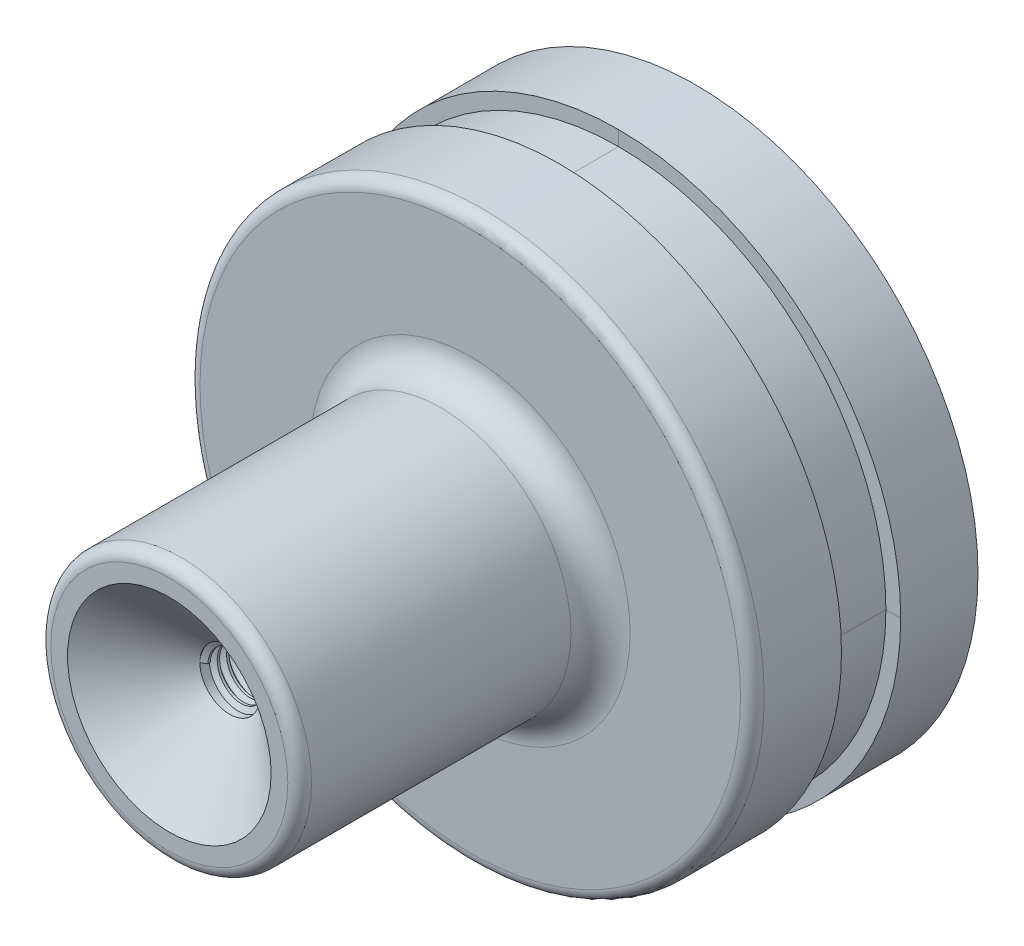
from build123d import *

# Parameters (mm, degrees)
SKETCH1_R                                           = 47.625
BOSS_EXTRUDE1_DEPTH                                 = 88.9
SKETCH2_OUTSIDE_W                                   = 129.528
SKETCH2_OUTSIDE_H                                   = 129.528
SKETCH2_OUTSIDE_R                                   = 22
CUT_EXTRUDE2_DEPTH                                  = 50.8
CSK_FOR_3_8_FLAT_HEAD_MACHINE_SCREW_100_D           = 10.0838
CSK_FOR_3_8_FLAT_HEAD_MACHINE_SCREW_100_DEPTH       = 25
CSK_FOR_3_8_FLAT_HEAD_MACHINE_SCREW_100_CSINK_D     = 34.3708482
CSK_FOR_3_8_FLAT_HEAD_MACHINE_SCREW_100_CSINK_ANGLE = 100
CSK_FOR_3_8_FLAT_HEAD_MACHINE_SCREW_100_TIP         = 3.029479155
THREAD1_PITCH                                       = 1.5875
FILLET1_R                                           = 2
FILLET2_R                                           = 5
SKETCH15_R                                          = 40.8125
CUT_EXTRUDE3_DEPTH                                  = 15
SKETCH19_W                                          = 10
SKETCH19_H                                          = 5
SCALE1_SCALE                                        = 0.49
SCALE2_SCALE                                        = 0.894
SCALE3_SCALE                                        = 0.8184


with BuildPart() as part:
    # Sketch1 → Boss-Extrude1 (new body)
    with BuildSketch(Plane.XY):
        Circle(SKETCH1_R)
    extrude(amount=BOSS_EXTRUDE1_DEPTH)

    # Sketch2 outside → Cut-Extrude2 (cut)
    with BuildSketch(Plane.XY.offset(88.9)):
        Rectangle(SKETCH2_OUTSIDE_W, SKETCH2_OUTSIDE_H)
        Circle(SKETCH2_OUTSIDE_R, mode=Mode.SUBTRACT)
    extrude(amount=-CUT_EXTRUDE2_DEPTH, mode=Mode.SUBTRACT)

    # CSK for 3/8 Flat Head Machine Screw (100)1
    with Locations(Plane.XY.offset(88.9)):
        with Locations((0, 0)):
            CounterSinkHole(CSK_FOR_3_8_FLAT_HEAD_MACHINE_SCREW_100_D / 2, CSK_FOR_3_8_FLAT_HEAD_MACHINE_SCREW_100_CSINK_D / 2, depth=CSK_FOR_3_8_FLAT_HEAD_MACHINE_SCREW_100_DEPTH, counter_sink_angle=CSK_FOR_3_8_FLAT_HEAD_MACHINE_SCREW_100_CSINK_ANGLE)
            with Locations((0, 0, -(CSK_FOR_3_8_FLAT_HEAD_MACHINE_SCREW_100_DEPTH + CSK_FOR_3_8_FLAT_HEAD_MACHINE_SCREW_100_TIP / 2))):  # 118° drill point
                Cone(0, CSK_FOR_3_8_FLAT_HEAD_MACHINE_SCREW_100_D / 2, CSK_FOR_3_8_FLAT_HEAD_MACHINE_SCREW_100_TIP, mode=Mode.SUBTRACT)

    # Thread1: the profile of Thread Profile1 profile screwed along a right-hand helix of 10.07874 turns, 8 arcs to a turn; built about Z, then put on its axis
    thread1_z = Axis((0, 0, 0), (0, 0, 1))
    thread1_corners = [(5.0422, 0, -0.000173206), (5.0422, 0, 1.3892357), (4.182640423, 0, 0.892968747), (4.182640423, 0, 0.496093747)]
    with BuildLine(mode=Mode.PRIVATE) as thread1_profile:
        Line(thread1_corners[0], thread1_corners[1])
        Line(thread1_corners[1], thread1_corners[2])
        Line(thread1_corners[2], thread1_corners[3])
        Line(thread1_corners[3], thread1_corners[0])
    thread1_cap = Face(thread1_profile.wire())
    thread1_turn_angles = [0, 22.5, 45, 67.5, 90, 112.5, 135, 157.5, 180, 202.5, 225, 247.5, 270, 292.5, 315, 337.5, 360]
    thread1_turn_weights = [1, 0.9238795325112867, 1, 0.9238795325112867, 1, 0.9238795325112867, 1, 0.9238795325112867, 1, 0.9238795325112867, 1, 0.9238795325112867, 1, 0.9238795325112867, 1, 0.9238795325112867, 1]
    thread1_turn_rails = [Edge.make_bspline([Vector(p[0], p[1], 0).rotate(thread1_z, thread1_turn_angles[k]) / thread1_turn_weights[k] + Vector(0, 0, p[2] + THREAD1_PITCH * thread1_turn_angles[k] / 360) for k in range(17)], [0, 0, 0, 1, 1, 2, 2, 3, 3, 4, 4, 5, 5, 6, 6, 7, 7, 8, 8, 8], 2, thread1_turn_weights) for p in thread1_corners]
    thread1_turn_sides = [Face.make_surface_from_curves(thread1_turn_rails[p[0]], thread1_turn_rails[p[1]]) for p in [(0, 1), (1, 2), (2, 3), (3, 0)]]
    thread1_last_angles = [3600, 3614.173228346, 3628.346456693]
    thread1_last_weights = [1, 0.9695598647982457, 1]
    thread1_last_rails = [Edge.make_bspline([Vector(p[0], p[1], 0).rotate(thread1_z, thread1_last_angles[k]) / thread1_last_weights[k] + Vector(0, 0, p[2] + THREAD1_PITCH * thread1_last_angles[k] / 360) for k in range(3)], [0, 0, 0, 1, 1, 1], 2, thread1_last_weights) for p in thread1_corners]
    thread1_last_sides = [Face.make_surface_from_curves(thread1_last_rails[p[0]], thread1_last_rails[p[1]]) for p in [(0, 1), (1, 2), (2, 3), (3, 0)]]
    thread1 = Plane(origin=(0, 0, 78.710373406), x_dir=(-1, 0, 0), z_dir=(0, 0, -1)) * Solid(Shell([*[p.moved(Location((0, 0, THREAD1_PITCH * i))) for i in range(10) for p in thread1_turn_sides], *thread1_last_sides, thread1_cap, thread1_cap.rotate(thread1_z, 3628.346456693).moved(Location((0, 0, THREAD1_PITCH * 3628.346456693 / 360)))]))
    add(thread1)

    # Fillet1
    fillet1_edges = [part.edges().sort_by_distance(p)[0] for p in [
        (-22, 0, 88.9),
        (-47.625, 0, 38.1),
    ]]
    fillet(fillet1_edges, radius=FILLET1_R)

    # Fillet2
    fillet2_edges = [part.edges().sort_by_distance(p)[0] for p in [
        (-22, 0, 38.1),
    ]]
    fillet(fillet2_edges, radius=FILLET2_R)

    # Sketch15 → Cut-Extrude3 (cut)
    with BuildSketch(Plane(origin=(0, 0, 0), x_dir=(-1, 0, 0), z_dir=(0, 0, -1))):
        Circle(SKETCH15_R)
    extrude(amount=-CUT_EXTRUDE3_DEPTH, mode=Mode.SUBTRACT)

    # Cut-Sweep1: sweep along a curve in space
    with BuildLine() as cut_sweep1_path:
        ThreePointArc((47.625, 0, 36.1), (33.675960454, 33.675960454, 36.1), (0, 47.625, 36.1))
        ThreePointArc((0, 47.625, 36.1), (-33.675960454, 33.675960454, 36.1), (-47.625, 0, 36.1))
        ThreePointArc((-47.625, 0, 36.1), (-33.675960454, -33.675960454, 36.1), (0, -47.625, 36.1))
        ThreePointArc((0, -47.625, 36.1), (33.675960454, -33.675960454, 36.1), (47.625, 0, 36.1))
    # Sketch19 → Cut-Sweep1 (sweep, cut)
    with BuildSketch(Plane(origin=(0, 0, 0), x_dir=(0, 0, -1), z_dir=(1, 0, 0))):
        with Locations((-18.05, 47.625)):
            Rectangle(SKETCH19_W, SKETCH19_H)
    sweep(path=cut_sweep1_path.line, mode=Mode.SUBTRACT)


with BuildPart() as part_1:
    # Scale1: scaled about (-2.5512e-05, 4.3724e-05, 34.582455786)
    add(part.part.scale(SCALE1_SCALE).moved(Location((-1.3011e-05, 2.2299e-05, 17.637052451))))


with BuildPart() as part_2:
    # Scale2: scaled about (-2.5512e-05, 4.3724e-05, 34.582455786)
    add(part_1.part.scale(SCALE2_SCALE).moved(Location((-2.704e-06, 4.635e-06, 3.665740313))))


with BuildPart() as part_3:
    # Scale3: scaled about (-2.5512e-05, 4.3724e-05, 34.582455786)
    add(part_2.part.scale(SCALE3_SCALE).moved(Location((-4.633e-06, 7.94e-06, 6.280173971))))


solid = part_3.part
